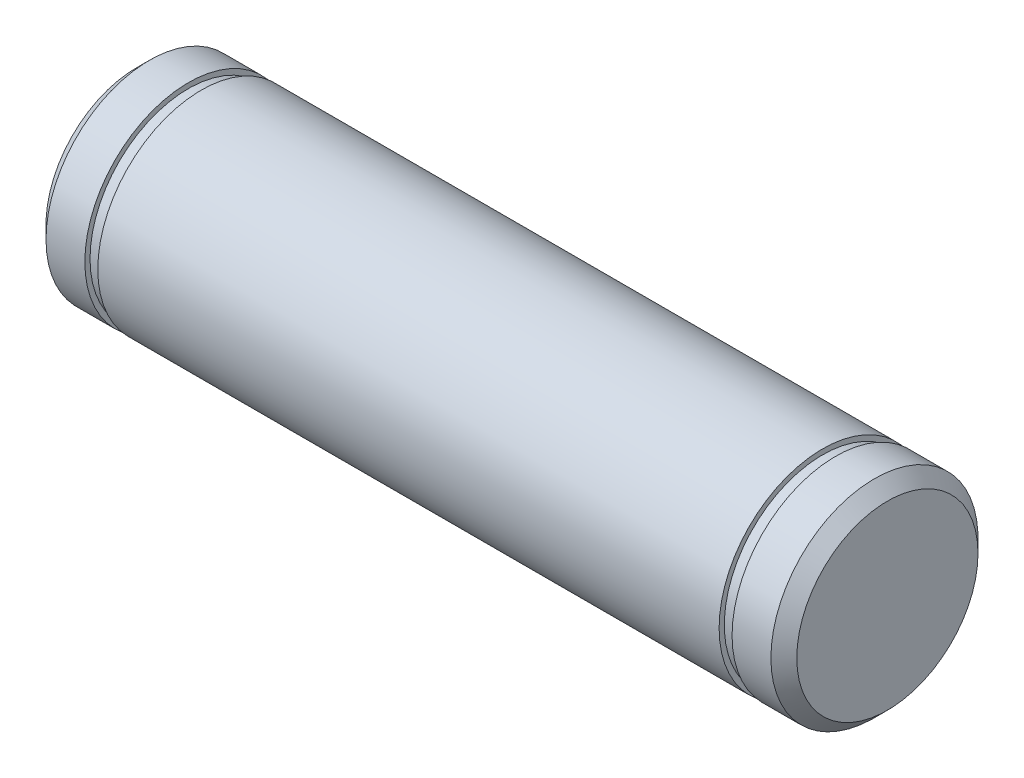
from build123d import *

# Parameters (mm, degrees)
SKETCH1_R           = 2
BOSS_EXTRUDE1_DEPTH = 14.5
CUT_EXTRUDE2_START  = -1
SKETCH2_R           = 2.498108329
SKETCH2_R_2         = 1.9
CUT_EXTRUDE2_DEPTH  = 0.25
CUT_EXTRUDE3_START  = -1.25
SKETCH3_R           = 2.5
SKETCH3_R_2         = 1.9
CUT_EXTRUDE3_DEPTH  = 0.25
CHAMFER1_SIZE       = 0.25


with BuildPart() as part:
    # Sketch1 → Boss-Extrude1 (new body)
    with BuildSketch(Plane(origin=(0, 0, 0), x_dir=(0, 0, -1), z_dir=(1, 0, 0))):
        Circle(SKETCH1_R)
    extrude(amount=BOSS_EXTRUDE1_DEPTH)

    # Sketch2 → Cut-Extrude2 (cut)
    with BuildSketch(Plane(origin=(14.5, 0, 0), x_dir=(0, 0, -1), z_dir=(1, 0, 0)).offset(CUT_EXTRUDE2_START)):
        Circle(SKETCH2_R)
        Circle(SKETCH2_R_2, mode=Mode.SUBTRACT)
    extrude(amount=-CUT_EXTRUDE2_DEPTH, mode=Mode.SUBTRACT)

    # Sketch3 → Cut-Extrude3 (cut)
    with BuildSketch(Plane.ZY.offset(CUT_EXTRUDE3_START)):
        Circle(SKETCH3_R)
        Circle(SKETCH3_R_2, mode=Mode.SUBTRACT)
    extrude(amount=CUT_EXTRUDE3_DEPTH, mode=Mode.SUBTRACT)

    # Chamfer1
    chamfer1_edges = [part.edges().sort_by_distance(p)[0] for p in [
        (14.5, 0, 2),
        (0, 0, 2),
    ]]
    chamfer(chamfer1_edges, length=CHAMFER1_SIZE)


solid = part.part
